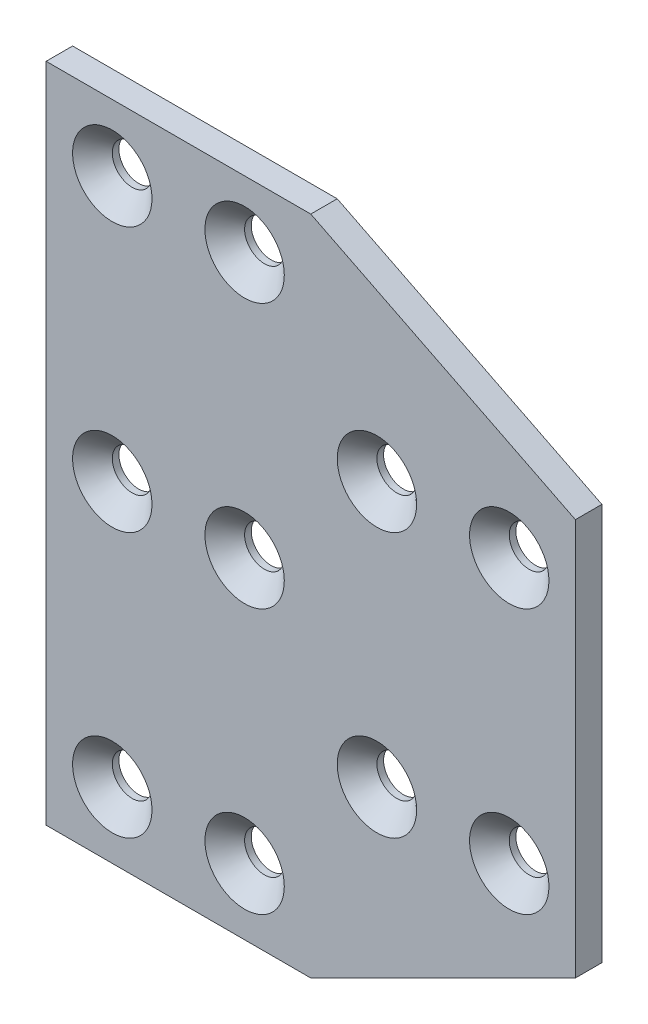
from build123d import *

# Parameters (mm, degrees)
SKETCH1_W           = 40
SKETCH1_H           = 100
SKETCH1_H_2         = 60
BOSS_EXTRUDE1_DEPTH = 2
SKETCH2_R           = 3
CUT_EXTRUDE1_DEPTH  = 79.204859184
CHAMFER1_SIZE       = 3


# Read off the part's stored shape, not the designer's step: Mirror2
with BuildPart() as part:
    # Sketch1 → Boss-Extrude1 (new, symmetric)
    with BuildSketch(Plane.XY):
        Rectangle(SKETCH1_W, SKETCH1_H)
        with Locations((40, 0)):
            Rectangle(SKETCH1_W, SKETCH1_H_2)
        Polygon((60, 30), (20, 50), (20, 30), align=None)
        Polygon((20, -30), (20, -50), (60, -30), align=None)
    extrude(amount=BOSS_EXTRUDE1_DEPTH, both=True)

    # Sketch2 → Cut-Extrude1 (cut, through all)
    with BuildSketch(Plane.XY.offset(2)):
        with Locations((50, 20)):
            Circle(SKETCH2_R)
        with Locations((30, 20)):
            Circle(SKETCH2_R)
        with Locations((-10, 0)):
            Circle(SKETCH2_R)
        with Locations((10, 0)):
            Circle(SKETCH2_R)
        with Locations((-10, 40)):
            Circle(SKETCH2_R)
        with Locations((10, 40)):
            Circle(SKETCH2_R)
    extrude(amount=-CUT_EXTRUDE1_DEPTH, mode=Mode.SUBTRACT)

    # Chamfer1
    chamfer1_edges = [part.edges().sort_by_distance(p)[0] for p in [
        (47, 20, 2),
        (7, 40, 2),
        (27, 20, 2),
        (-13, 0, 2),
        (7, 0, 2),
        (-13, 40, 2),
    ]]
    chamfer(chamfer1_edges, length=CHAMFER1_SIZE)

    # Mirror2 outline → Mirror2 (revolve, cut)
    with BuildSketch(Plane(origin=(-10, -40, 0), x_dir=(1, 0, 0), z_dir=(0, -1, 0))):
        Polygon((0, -2), (3, -2), (3, -1), (6, 2), (0, 2), align=None)
    revolve(axis=Axis((-10, -40, 0), (0, 0, 1)), mode=Mode.SUBTRACT)

    # Mirror2 2 outline → Mirror2 2 (revolve, cut)
    with BuildSketch(Plane(origin=(50, -20, 0), x_dir=(1, 0, 0), z_dir=(0, -1, 0))):
        Polygon((0, -2), (3, -2), (3, -1), (6, 2), (0, 2), align=None)
    revolve(axis=Axis((50, -20, 0), (0, 0, 1)), mode=Mode.SUBTRACT)

    # Mirror2 3 outline → Mirror2 3 (revolve, cut)
    with BuildSketch(Plane(origin=(30, -20, 0), x_dir=(1, 0, 0), z_dir=(0, -1, 0))):
        Polygon((0, -2), (3, -2), (3, -1), (6, 2), (0, 2), align=None)
    revolve(axis=Axis((30, -20, 0), (0, 0, 1)), mode=Mode.SUBTRACT)

    # Mirror2 4 outline → Mirror2 4 (revolve, cut)
    with BuildSketch(Plane(origin=(10, -40, 0), x_dir=(1, 0, 0), z_dir=(0, -1, 0))):
        Polygon((0, -2), (3, -2), (3, -1), (6, 2), (0, 2), align=None)
    revolve(axis=Axis((10, -40, 0), (0, 0, 1)), mode=Mode.SUBTRACT)


solid = part.part
